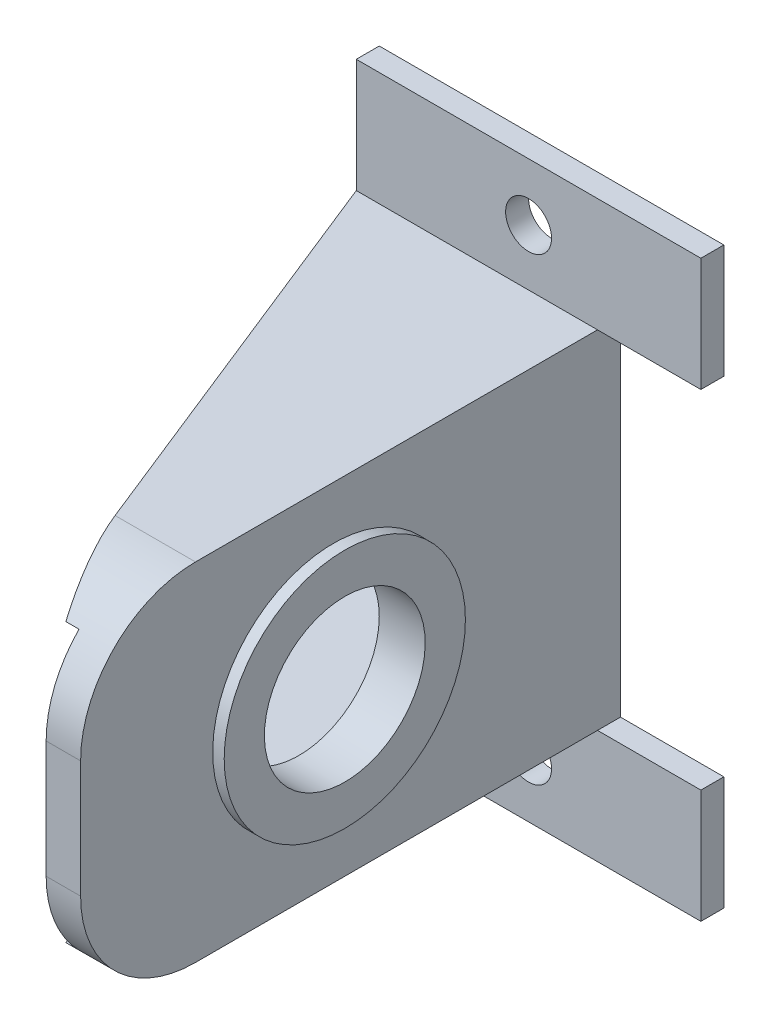
from build123d import *

# Parameters (mm, degrees)
ESQUISSE1_R             = 2
BOSS_EXTRU_1_DEPTH      = 2
BOSS_EXTRU_2_DEPTH      = 45
ENL_V_MAT_EXTRU_2_REACH = 70.68
ESQUISSE4_R             = 10.5
BOSS_EXTRU_3_DEPTH      = 1
ENL_V_MAT_EXTRU_3_REACH = 74.062
ESQUISSE5_R             = 7
CONG_1_R                = 10


with BuildPart() as part:
    # Esquisse1 → Boss.-Extru.1 (new body)
    with BuildSketch(Plane.XY):
        Polygon((30, 40.1), (21, 40.1), (21, 9.9), (30, 9.9), (30, 0), (0, 0), (0, 50), (30, 50), align=None)
        with Locations((15, 45)):
            Circle(ESQUISSE1_R, mode=Mode.SUBTRACT)
        with Locations((15, 5)):
            Circle(ESQUISSE1_R, mode=Mode.SUBTRACT)
    extrude(amount=BOSS_EXTRU_1_DEPTH)

    # Esquisse2 → Boss.-Extru.2 (add)
    with BuildSketch(Plane.XY.offset(2)):
        Polygon((18, 40.1), (0, 40.1), (0, 37.1), (18, 37.1), (18, 12.9), (0, 12.9), (0, 9.9), (18, 9.9), (21, 9.9), (21, 40.1), align=None)
    extrude(amount=BOSS_EXTRU_2_DEPTH)

    # Enlèv. mat.-Extru.2: up to this face of the body (flat: up to its plane)
    enl_v_mat_extru_2_end = Plane(part.part.faces().sort_by_distance((10.5, 40.1, 24.5))[0])
    # Esquisse3 → Enlèv. mat.-Extru.2 (cut, up to the picked face)
    with BuildSketch(Plane.XZ.offset(-9.9), mode=Mode.PRIVATE) as enl_v_mat_extru_2_sk1:
        Polygon((0, 2), (18, 47), (0, 47), align=None)
    enl_v_mat_extru_2_tool1 = split(extrude(enl_v_mat_extru_2_sk1.sketch, amount=-ENL_V_MAT_EXTRU_2_REACH, mode=Mode.PRIVATE), bisect_by=enl_v_mat_extru_2_end, keep=Keep.BOTH, mode=Mode.PRIVATE)
    add(enl_v_mat_extru_2_tool1.solids().sort_by(Axis((6, 9.9, 32), (0, 1, 0)))[0], mode=Mode.SUBTRACT)

    # Esquisse4 → Boss.-Extru.3 (add)
    with BuildSketch(Plane(origin=(21, 0, 0), x_dir=(0, 0, -1), z_dir=(1, 0, 0))):
        with Locations(Location((-25, 25, 0), (0, 0, 270))):
            Circle(ESQUISSE4_R)
    extrude(amount=BOSS_EXTRU_3_DEPTH)

    # Esquisse5 → Enlèv. mat.-Extru.3 (cut, up to next)
    with BuildSketch(Plane(origin=(22, 0, 0), x_dir=(0, 0, -1), z_dir=(1, 0, 0)), mode=Mode.PRIVATE) as enl_v_mat_extru_3_sk1:
        with Locations(Location((-25, 25, 0), (0, 0, 90))):
            Circle(ESQUISSE5_R)
    enl_v_mat_extru_3_tool1 = extrude(enl_v_mat_extru_3_sk1.sketch, amount=-ENL_V_MAT_EXTRU_3_REACH, mode=Mode.PRIVATE) & part.part
    add(enl_v_mat_extru_3_tool1.solids().sort_by_distance((22, 25, 25))[0], mode=Mode.SUBTRACT)

    # Congé1
    # the kernel refuses this fillet: 10 mm, written as the material it takes off along each edge
    with BuildSketch(Plane(origin=(-7, 40.1, 47), x_dir=(0, 0, -1), z_dir=(1, 0, 0))) as cong_1_piece_1:
        with BuildLine():
            CenterArc((CONG_1_R, -CONG_1_R), CONG_1_R, 90, 90)
            Line((0, -CONG_1_R), (0, 0))
            Line((0, 0), (CONG_1_R, 0))
        make_face()
    extrude(amount=53, mode=Mode.SUBTRACT)
    with BuildSketch(Plane(origin=(46, 9.9, 47), x_dir=(0, 1, 0), z_dir=(-1, 0, 0))) as cong_1_piece_2:
        with BuildLine():
            CenterArc((CONG_1_R, CONG_1_R), CONG_1_R, 180, 90)
            Line((0, CONG_1_R), (0, 0))
            Line((0, 0), (CONG_1_R, 0))
        make_face()
    extrude(amount=53, mode=Mode.SUBTRACT)


solid = part.part
